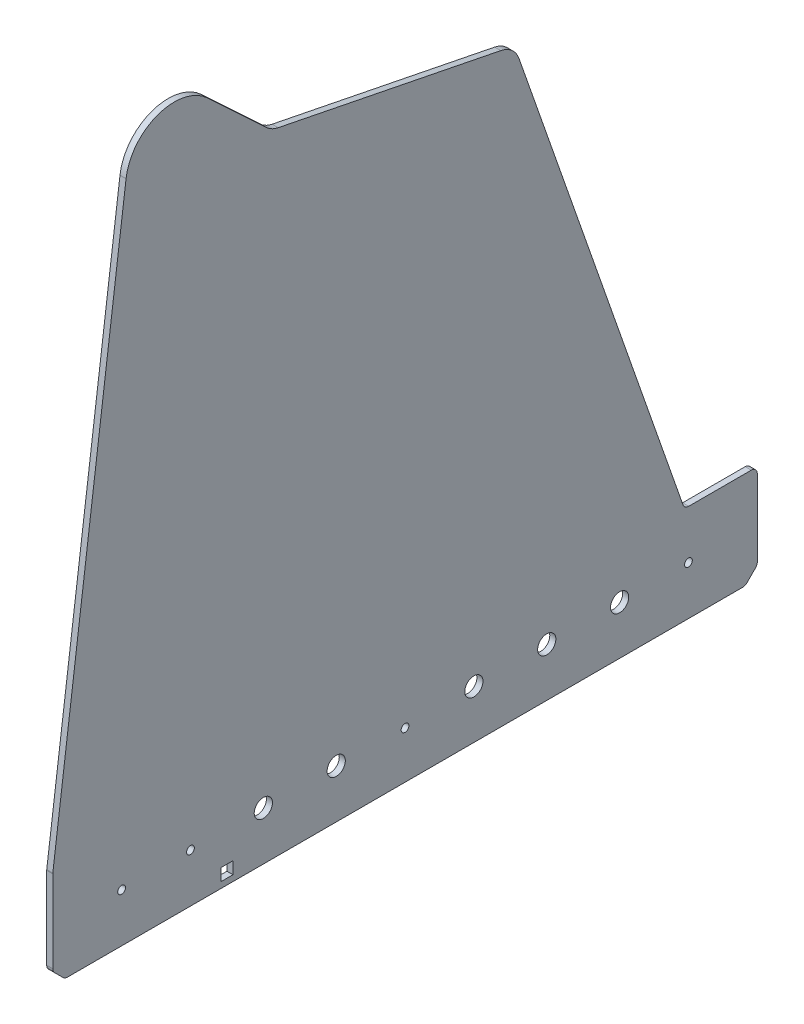
from build123d import *

# Parameters (mm, degrees)
BOSS_EXTRUDE1_DEPTH = 3.175
CHAMFER1_SIZE       = 6.35
FILLET1_R           = 12.7
FILLET2_R           = 3.175
FILLET3_R           = 3.175
CUT_EXTRUDE1_REACH  = 391.932
SKETCH16_R          = 4.7625
CUT_EXTRUDE2_REACH  = 391.932
SKETCH21_R          = 2.032
CUT_EXTRUDE3_REACH  = 391.932
SKETCH22_W          = 6.35
SKETCH22_H          = 6.35


with BuildPart() as part:
    # Sketch1 → Boss-Extrude1 (new body)
    with BuildSketch(Plane(origin=(0, 0, 0), x_dir=(0, 0, -1), z_dir=(1, 0, 0))):
        with BuildLine():
            Line((-184.15, -24.60625), (184.15, -24.60625))
            Line((184.15, -24.60625), (184.15, 26.19375))
            Line((184.15, 26.19375), (146.05, 26.19375))
            Line((146.05, 26.19375), (57.15, 280.19375))
            Line((57.15, 280.19375), (-69.85, 305.59375))
            Line((-69.85, 305.59375), (-103.309941035, 336.853985858))
            ThreePointArc((-103.309941035, 336.853985858), (-129.244818111, 342.195404789), (-145.838997174, 321.560923299))
            Line((-145.838997174, 321.560923299), (-184.15, 26.19375))
            Line((-184.15, 26.19375), (-184.15, -24.60625))
        make_face()
    extrude(amount=BOSS_EXTRUDE1_DEPTH)

    # Chamfer1
    chamfer1_edges = [part.edges().sort_by_distance(p)[0] for p in [
        (1.5875, -24.60625, 184.15),
        (1.5875, -24.60625, -184.15),
    ]]
    chamfer(chamfer1_edges, length=CHAMFER1_SIZE)

    # Fillet1
    fillet1_edges = [part.edges().sort_by_distance(p)[0] for p in [
        (1.5875, 305.59375, 69.85),
        (1.5875, 280.19375, -57.15),
    ]]
    fillet(fillet1_edges, radius=FILLET1_R)

    # Fillet2
    fillet2_edges = [part.edges().sort_by_distance(p)[0] for p in [
        (1.5875, 26.19375, 184.15),
        (1.5875, 26.19375, -184.15),
        (1.5875, 26.19375, -146.05),
    ]]
    fillet(fillet2_edges, radius=FILLET2_R)

    # Fillet3
    fillet3_edges = [part.edges().sort_by_distance(p)[0] for p in [
        (1.5875, -18.25625, -184.15),
        (1.5875, -24.60625, -177.8),
        (1.5875, -18.25625, 184.15),
        (1.5875, -24.60625, 177.8),
    ]]
    fillet(fillet3_edges, radius=FILLET3_R)

    # Sketch16 → Cut-Extrude1 (cut, up to next)
    with BuildSketch(Plane(origin=(3.175, 0, 0), x_dir=(0, 0, -1), z_dir=(1, 0, 0)), mode=Mode.PRIVATE) as cut_extrude1_sk1:
        with Locations((112.174577673, 0.79375)):
            Circle(SKETCH16_R)
    cut_extrude1_tool1 = extrude(cut_extrude1_sk1.sketch, amount=-CUT_EXTRUDE1_REACH, mode=Mode.PRIVATE) & part.part
    # Sketch16 → Cut-Extrude1 (cut, up to next)
    with BuildSketch(Plane(origin=(3.175, 0, 0), x_dir=(0, 0, -1), z_dir=(1, 0, 0)), mode=Mode.PRIVATE) as cut_extrude1_sk2:
        with Locations((74.074577673, 0.79375)):
            Circle(SKETCH16_R)
    cut_extrude1_tool2 = extrude(cut_extrude1_sk2.sketch, amount=-CUT_EXTRUDE1_REACH, mode=Mode.PRIVATE) & part.part
    # Sketch16 → Cut-Extrude1 (cut, up to next)
    with BuildSketch(Plane(origin=(3.175, 0, 0), x_dir=(0, 0, -1), z_dir=(1, 0, 0)), mode=Mode.PRIVATE) as cut_extrude1_sk3:
        with Locations((35.974577673, 0.79375)):
            Circle(SKETCH16_R)
    cut_extrude1_tool3 = extrude(cut_extrude1_sk3.sketch, amount=-CUT_EXTRUDE1_REACH, mode=Mode.PRIVATE) & part.part
    # Sketch16 → Cut-Extrude1 (cut, up to next)
    with BuildSketch(Plane(origin=(3.175, 0, 0), x_dir=(0, 0, -1), z_dir=(1, 0, 0)), mode=Mode.PRIVATE) as cut_extrude1_sk4:
        with Locations((-35.974577673, 0.79375)):
            Circle(SKETCH16_R)
    cut_extrude1_tool4 = extrude(cut_extrude1_sk4.sketch, amount=-CUT_EXTRUDE1_REACH, mode=Mode.PRIVATE) & part.part
    # Sketch16 → Cut-Extrude1 (cut, up to next)
    with BuildSketch(Plane(origin=(3.175, 0, 0), x_dir=(0, 0, -1), z_dir=(1, 0, 0)), mode=Mode.PRIVATE) as cut_extrude1_sk5:
        with Locations((-74.074577673, 0.79375)):
            Circle(SKETCH16_R)
    cut_extrude1_tool5 = extrude(cut_extrude1_sk5.sketch, amount=-CUT_EXTRUDE1_REACH, mode=Mode.PRIVATE) & part.part
    add(cut_extrude1_tool1.solids().sort_by_distance((3.175, 0.79375, -112.174578))[0], mode=Mode.SUBTRACT)
    add(cut_extrude1_tool2.solids().sort_by_distance((3.175, 0.79375, -74.074578))[0], mode=Mode.SUBTRACT)
    add(cut_extrude1_tool3.solids().sort_by_distance((3.175, 0.79375, -35.974578))[0], mode=Mode.SUBTRACT)
    add(cut_extrude1_tool4.solids().sort_by_distance((3.175, 0.79375, 35.974578))[0], mode=Mode.SUBTRACT)
    add(cut_extrude1_tool5.solids().sort_by_distance((3.175, 0.79375, 74.074578))[0], mode=Mode.SUBTRACT)

    # Sketch21 → Cut-Extrude2 (cut, up to next)
    with BuildSketch(Plane(origin=(3.175, 0, 0), x_dir=(0, 0, -1), z_dir=(1, 0, 0)), mode=Mode.PRIVATE) as cut_extrude2_sk1:
        with Locations((-148.157911006, 0.79375)):
            Circle(SKETCH21_R)
    cut_extrude2_tool1 = extrude(cut_extrude2_sk1.sketch, amount=-CUT_EXTRUDE2_REACH, mode=Mode.PRIVATE) & part.part
    # Sketch21 → Cut-Extrude2 (cut, up to next)
    with BuildSketch(Plane(origin=(3.175, 0, 0), x_dir=(0, 0, -1), z_dir=(1, 0, 0)), mode=Mode.PRIVATE) as cut_extrude2_sk2:
        with Locations((-112.174577673, 0.79375)):
            Circle(SKETCH21_R)
    cut_extrude2_tool2 = extrude(cut_extrude2_sk2.sketch, amount=-CUT_EXTRUDE2_REACH, mode=Mode.PRIVATE) & part.part
    # Sketch21 → Cut-Extrude2 (cut, up to next)
    with BuildSketch(Plane(origin=(3.175, 0, 0), x_dir=(0, 0, -1), z_dir=(1, 0, 0)), mode=Mode.PRIVATE) as cut_extrude2_sk3:
        Circle(SKETCH21_R)
    cut_extrude2_tool3 = extrude(cut_extrude2_sk3.sketch, amount=-CUT_EXTRUDE2_REACH, mode=Mode.PRIVATE) & part.part
    # Sketch21 → Cut-Extrude2 (cut, up to next)
    with BuildSketch(Plane(origin=(3.175, 0, 0), x_dir=(0, 0, -1), z_dir=(1, 0, 0)), mode=Mode.PRIVATE) as cut_extrude2_sk4:
        with Locations((148.157911006, 0.79375)):
            Circle(SKETCH21_R)
    cut_extrude2_tool4 = extrude(cut_extrude2_sk4.sketch, amount=-CUT_EXTRUDE2_REACH, mode=Mode.PRIVATE) & part.part
    add(cut_extrude2_tool1.solids().sort_by_distance((3.175, 0.79375, 148.157911))[0], mode=Mode.SUBTRACT)
    add(cut_extrude2_tool2.solids().sort_by_distance((3.175, 0.79375, 112.174578))[0], mode=Mode.SUBTRACT)
    add(cut_extrude2_tool3.solids().sort_by_distance((3.175, 0, 0))[0], mode=Mode.SUBTRACT)
    add(cut_extrude2_tool4.solids().sort_by_distance((3.175, 0.79375, -148.157911))[0], mode=Mode.SUBTRACT)

    # Sketch22 → Cut-Extrude3 (cut, up to next)
    with BuildSketch(Plane(origin=(3.175, 0, 0), x_dir=(0, 0, -1), z_dir=(1, 0, 0)), mode=Mode.PRIVATE) as cut_extrude3_sk1:
        with Locations((-93.124577673, -18.322281394)):
            Rectangle(SKETCH22_W, SKETCH22_H)
    cut_extrude3_tool1 = extrude(cut_extrude3_sk1.sketch, amount=-CUT_EXTRUDE3_REACH, mode=Mode.PRIVATE) & part.part
    add(cut_extrude3_tool1.solids().sort_by_distance((3.175, -18.322281, 93.124578))[0], mode=Mode.SUBTRACT)


solid = part.part
